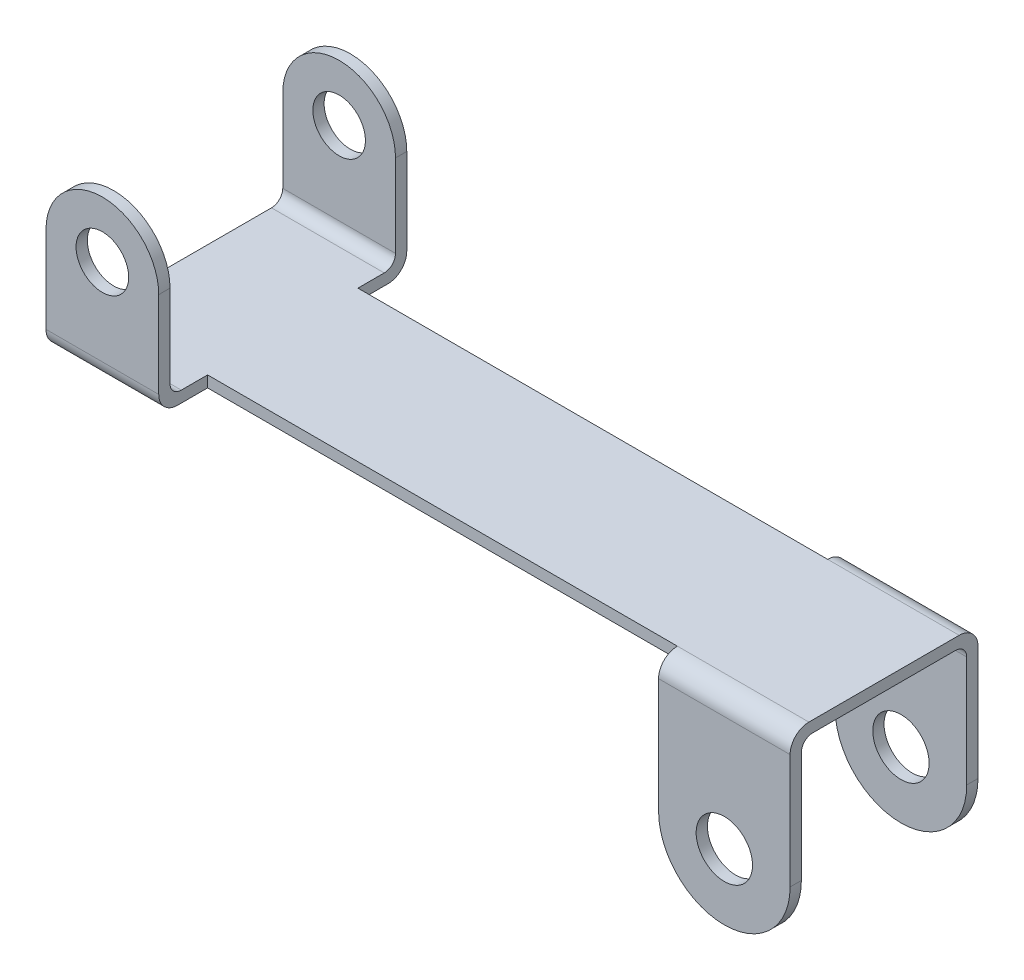
from build123d import *

# Parameters (mm, degrees)
SKETCH1_W           = 19
SKETCH1_H           = 4
BOSS_EXTRUDE1_DEPTH = 0.3
SKETCH2_W           = 3
SKETCH2_H           = 1.3
BOSS_EXTRUDE2_DEPTH = 0.3
SKETCH3_W           = 3
SKETCH3_H           = 0.3
BOSS_EXTRUDE3_DEPTH = 4
FILLET1_RADIUS      = 1.5
FILLET1_LENGTH      = 0.3
FILLET2_RADIUS      = 1.5
FILLET2_LENGTH      = 0.3
SKETCH4_R           = 0.7
CUT_EXTRUDE1_DEPTH  = 21.568179307
SKETCH6_W           = 3.5
SKETCH6_H           = 0.5
BOSS_EXTRUDE4_DEPTH = 0.3
SKETCH7_W           = 3.5
SKETCH7_H           = 0.3
BOSS_EXTRUDE5_DEPTH = 5
FILLET3_RADIUS      = 1.75
FILLET3_LENGTH      = 0.3
FILLET4_RADIUS      = 1.75
FILLET4_LENGTH      = 0.3
SKETCH8_R           = 0.75
CUT_EXTRUDE2_DEPTH  = 21.485116548
FILLET5_R           = 0.3
FILLET6_R           = 0.5


with BuildPart() as part:
    # Sketch1 → Boss-Extrude1 (new body)
    with BuildSketch(Plane(origin=(0, 0, 0), x_dir=(1, 0, 0), z_dir=(0, 1, 0))):
        with Locations((9.5, -2)):
            Rectangle(SKETCH1_W, SKETCH1_H)
    extrude(amount=BOSS_EXTRUDE1_DEPTH)

    # Sketch2 → Boss-Extrude2 (add)
    with BuildSketch(Plane.XZ):
        with Locations((1.5, -0.65)):
            Rectangle(SKETCH2_W, SKETCH2_H)
        with Locations((1.5, 4.65)):
            Rectangle(SKETCH2_W, SKETCH2_H)
    extrude(amount=-BOSS_EXTRUDE2_DEPTH)

    # Sketch3 → Boss-Extrude3 (add)
    with BuildSketch(Plane(origin=(0, 0.3, 0), x_dir=(1, 0, 0), z_dir=(0, 1, 0))):
        with Locations((1.5, 1.15)):
            Rectangle(SKETCH3_W, SKETCH3_H)
        with Locations((1.5, -5.15)):
            Rectangle(SKETCH3_W, SKETCH3_H)
    extrude(amount=BOSS_EXTRUDE3_DEPTH)

    # Fillet1: full round fillet: the end face becomes a half cylinder, R = half its width
    fillet1_face = Plane((1.5, 4.3, -1.15), x_dir=(0, 0, 1), z_dir=(0, 1, 0))  # on the end face: x along it, z out of the body
    fillet1_slab = fillet1_face.offset(-FILLET1_RADIUS / 2) * Box(FILLET1_LENGTH, 2 * FILLET1_RADIUS, FILLET1_RADIUS, mode=Mode.PRIVATE)  # the body's end, R deep
    fillet1_round = Plane((1.5, 2.8, -1.15), x_dir=(0, 1, 0), z_dir=(0, 0, 1)) * Cylinder(FILLET1_RADIUS, FILLET1_LENGTH, mode=Mode.PRIVATE)  # its axis R under the face
    add(fillet1_slab - fillet1_round, mode=Mode.SUBTRACT)

    # Fillet2: full round fillet: the end face becomes a half cylinder, R = half its width
    fillet2_face = Plane((1.5, 4.3, 5.15), x_dir=(0, 0, -1), z_dir=(0, 1, 0))  # on the end face: x along it, z out of the body
    fillet2_slab = fillet2_face.offset(-FILLET2_RADIUS / 2) * Box(FILLET2_LENGTH, 2 * FILLET2_RADIUS, FILLET2_RADIUS, mode=Mode.PRIVATE)  # the body's end, R deep
    fillet2_round = Plane((1.5, 2.8, 5.15), x_dir=(0, 1, 0), z_dir=(0, 0, -1)) * Cylinder(FILLET2_RADIUS, FILLET2_LENGTH, mode=Mode.PRIVATE)  # its axis R under the face
    add(fillet2_slab - fillet2_round, mode=Mode.SUBTRACT)

    # Sketch4 → Cut-Extrude1 (cut, through all)
    with BuildSketch(Plane(origin=(0, 0, -1.3), x_dir=(-1, 0, 0), z_dir=(0, 0, -1))):
        with Locations((-1.5, 2.8)):
            Circle(SKETCH4_R)
    extrude(amount=-CUT_EXTRUDE1_DEPTH, mode=Mode.SUBTRACT)

    # Sketch6 → Boss-Extrude4 (add)
    with BuildSketch(Plane(origin=(0, 0.3, 0), x_dir=(1, 0, 0), z_dir=(0, 1, 0))):
        with Locations((17.25, 0.25)):
            Rectangle(SKETCH6_W, SKETCH6_H)
        with Locations((17.25, -4.25)):
            Rectangle(SKETCH6_W, SKETCH6_H)
    extrude(amount=-BOSS_EXTRUDE4_DEPTH)

    # Sketch7 → Boss-Extrude5 (add)
    with BuildSketch(Plane.XZ):
        with Locations((17.25, -0.35)):
            Rectangle(SKETCH7_W, SKETCH7_H)
        with Locations((17.25, 4.35)):
            Rectangle(SKETCH7_W, SKETCH7_H)
    extrude(amount=BOSS_EXTRUDE5_DEPTH)

    # Fillet3: full round fillet: the end face becomes a half cylinder, R = half its width
    fillet3_face = Plane((17.25, -5, 4.35), x_dir=(0, 0, -1), z_dir=(0, -1, 0))  # on the end face: x along it, z out of the body
    fillet3_slab = fillet3_face.offset(-FILLET3_RADIUS / 2) * Box(FILLET3_LENGTH, 2 * FILLET3_RADIUS, FILLET3_RADIUS, mode=Mode.PRIVATE)  # the body's end, R deep
    fillet3_round = Plane((17.25, -3.25, 4.35), x_dir=(0, -1, 0), z_dir=(0, 0, -1)) * Cylinder(FILLET3_RADIUS, FILLET3_LENGTH, mode=Mode.PRIVATE)  # its axis R under the face
    add(fillet3_slab - fillet3_round, mode=Mode.SUBTRACT)

    # Fillet4: full round fillet: the end face becomes a half cylinder, R = half its width
    fillet4_face = Plane((17.25, -5, -0.35), x_dir=(0, 0, -1), z_dir=(0, -1, 0))  # on the end face: x along it, z out of the body
    fillet4_slab = fillet4_face.offset(-FILLET4_RADIUS / 2) * Box(FILLET4_LENGTH, 2 * FILLET4_RADIUS, FILLET4_RADIUS, mode=Mode.PRIVATE)  # the body's end, R deep
    fillet4_round = Plane((17.25, -3.25, -0.35), x_dir=(0, -1, 0), z_dir=(0, 0, -1)) * Cylinder(FILLET4_RADIUS, FILLET4_LENGTH, mode=Mode.PRIVATE)  # its axis R under the face
    add(fillet4_slab - fillet4_round, mode=Mode.SUBTRACT)

    # Sketch8 → Cut-Extrude2 (cut, through all)
    with BuildSketch(Plane.XY.offset(4.5)):
        with Locations((17.25, -3.25)):
            Circle(SKETCH8_R)
    extrude(amount=-CUT_EXTRUDE2_DEPTH, mode=Mode.SUBTRACT)

    # Fillet5
    # the kernel refuses this fillet: 0.3 mm, written as the material it adds along each edge
    with BuildSketch(Plane(origin=(19, 0, -0.2), x_dir=(0, 0, 1), z_dir=(-1, 0, 0))) as fillet5_piece_1:
        with BuildLine():
            CenterArc((FILLET5_R, -FILLET5_R), FILLET5_R, 90, 90)
            Line((0, -FILLET5_R), (0, 0))
            Line((0, 0), (FILLET5_R, 0))
        make_face()
    extrude(amount=3.5)
    with BuildSketch(Plane(origin=(19, 0, 4.2), x_dir=(0, 0, -1), z_dir=(-1, 0, 0))) as fillet5_piece_2:
        with BuildLine():
            CenterArc((FILLET5_R, FILLET5_R), FILLET5_R, 180, 90)
            Line((0, FILLET5_R), (0, 0))
            Line((0, 0), (FILLET5_R, 0))
        make_face()
    extrude(amount=3.5)
    with BuildSketch(Plane(origin=(3, 0.3, -1), x_dir=(0, 0, 1), z_dir=(-1, 0, 0)), Plane(origin=(0, 0.3, 5), x_dir=(0, 0, -1), z_dir=(1, 0, 0))) as fillet5_piece_3:
        with BuildLine():
            CenterArc((FILLET5_R, FILLET5_R), FILLET5_R, 180, 90)
            Line((0, FILLET5_R), (0, 0))
            Line((0, 0), (FILLET5_R, 0))
        make_face()
    extrude(amount=3)

    # Fillet6
    fillet6_edges = [part.edges().sort_by_distance(p)[0] for p in [
        (1.5, 0, 5.3),
        (1.5, 0, -1.3),
        (17.25, 0.3, 4.5),
        (17.25, 0.3, -0.5),
    ]]
    fillet(fillet6_edges, radius=FILLET6_R)


solid = part.part
